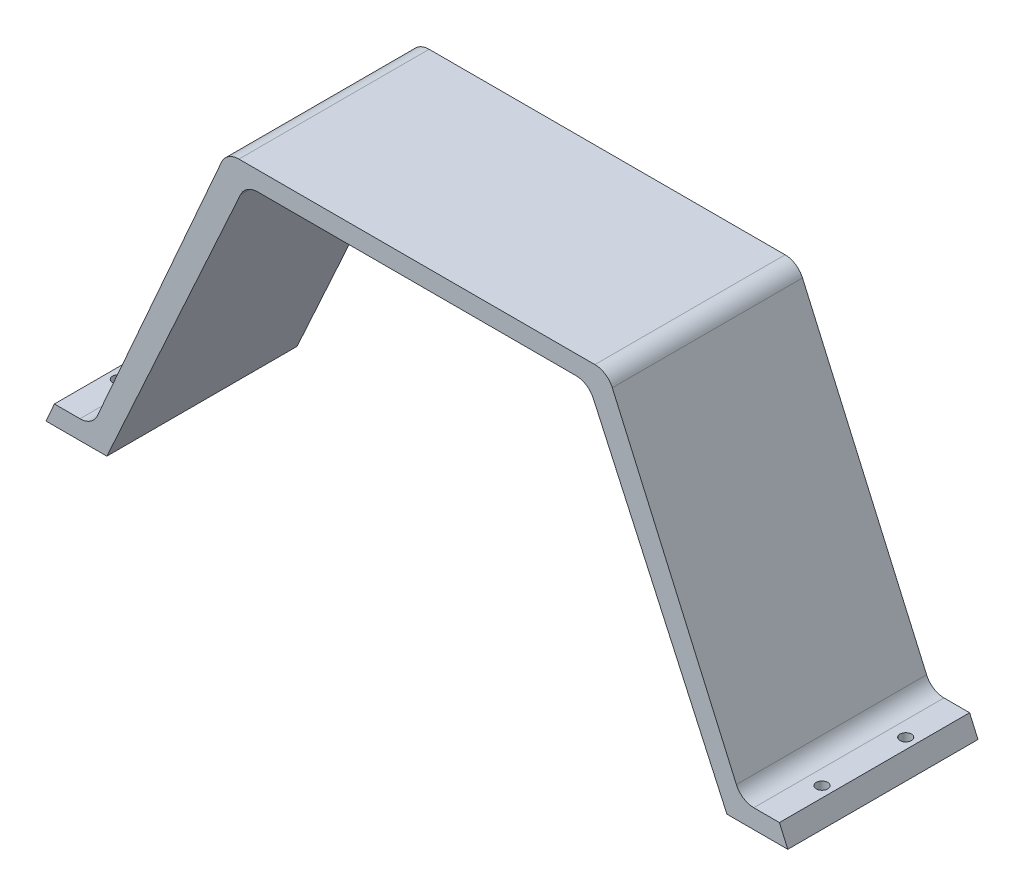
from build123d import *

# Parameters (mm, degrees)
BOSS_EXTRUDE2_DEPTH = 50
CUT_EXTRUDE1_DEPTH  = 50
FILLET1_R           = 5
SKETCH10_W          = 50
SKETCH10_H          = 5.46
BOSS_EXTRUDE4_DEPTH = 10
SKETCH5_W           = 50
SKETCH5_H           = 5.464
BOSS_EXTRUDE5_DEPTH = 10
SKETCH11_R          = 1.5
CUT_EXTRUDE2_DEPTH  = 10
SKETCH12_R          = 1.5
CUT_EXTRUDE3_DEPTH  = 10
FILLET2_R           = 5
FILLET3_R           = 5


with BuildPart() as part:
    # Sketch1 → Boss-Extrude2 (new body)
    with BuildSketch(Plane.XY):
        Polygon((-87.5, 0), (87.5, 0), (50.05, 85), (-50.05, 85), align=None)
    extrude(amount=BOSS_EXTRUDE2_DEPTH)

    # Sketch3 → Cut-Extrude1 (cut)
    with BuildSketch(Plane.XY.offset(50)):
        Polygon((-81.5, 0), (81.5, 0), (45.05, 80), (-45.05, 80), align=None)
    extrude(amount=-CUT_EXTRUDE1_DEPTH, mode=Mode.SUBTRACT)

    # Fillet1
    fillet1_edges = [part.edges().sort_by_distance(p)[0] for p in [
        (45.05, 80, 25),
        (-45.05, 80, 25),
    ]]
    fillet(fillet1_edges, radius=FILLET1_R)

    # Sketch10 → Boss-Extrude4 (add, along a direction that is not the sketch's normal)
    with BuildSketch(Plane(origin=(-73.275840836, 32.284473404, 0), x_dir=(0, 0, 1), z_dir=(-0.9151164849241618, 0.4031895571812924, 0))):
        with Locations((25, -32.549086253)):
            Rectangle(SKETCH10_W, SKETCH10_H)
    extrude(amount=BOSS_EXTRUDE4_DEPTH, dir=(-1, 0, 0))

    # Sketch5 → Boss-Extrude5 (add, along a direction that is not the sketch's normal)
    with BuildSketch(Plane(origin=(73.275840836, 32.284473404, 0), x_dir=(0, 0, -1), z_dir=(0.9151164849241616, 0.4031895571812925, 0))):
        with Locations((-25, -32.547086253)):
            Rectangle(SKETCH5_W, SKETCH5_H)
    extrude(amount=BOSS_EXTRUDE5_DEPTH, dir=(1, 0, 0))

    # Sketch11 → Cut-Extrude2 (cut)
    with BuildSketch(Plane(origin=(0, 4.996536008, 0), x_dir=(1, 0, 0), z_dir=(0, 1, 0))):
        with Locations((-92.5, -14)):
            Circle(SKETCH11_R)
        with Locations((-92.5, -36)):
            Circle(SKETCH11_R)
    extrude(amount=-CUT_EXTRUDE2_DEPTH, mode=Mode.SUBTRACT)

    # Sketch12 → Cut-Extrude3 (cut)
    with BuildSketch(Plane(origin=(0, 5.000196474, 0), x_dir=(1, 0, 0), z_dir=(0, 1, 0))):
        with Locations((92.5, -14)):
            Circle(SKETCH12_R)
        with Locations((92.5, -36)):
            Circle(SKETCH12_R)
    extrude(amount=-CUT_EXTRUDE3_DEPTH, mode=Mode.SUBTRACT)

    # Fillet2
    fillet2_edges = [part.edges().sort_by_distance(p)[0] for p in [
        (85.29697226, 5.000196474, 25),
        (-85.298585018, 4.996536008, 25),
    ]]
    fillet(fillet2_edges, radius=FILLET2_R)

    # Fillet3
    fillet3_edges = [part.edges().sort_by_distance(p)[0] for p in [
        (50.05, 85, 25),
        (-50.05, 85, 25),
    ]]
    fillet(fillet3_edges, radius=FILLET3_R)


solid = part.part
